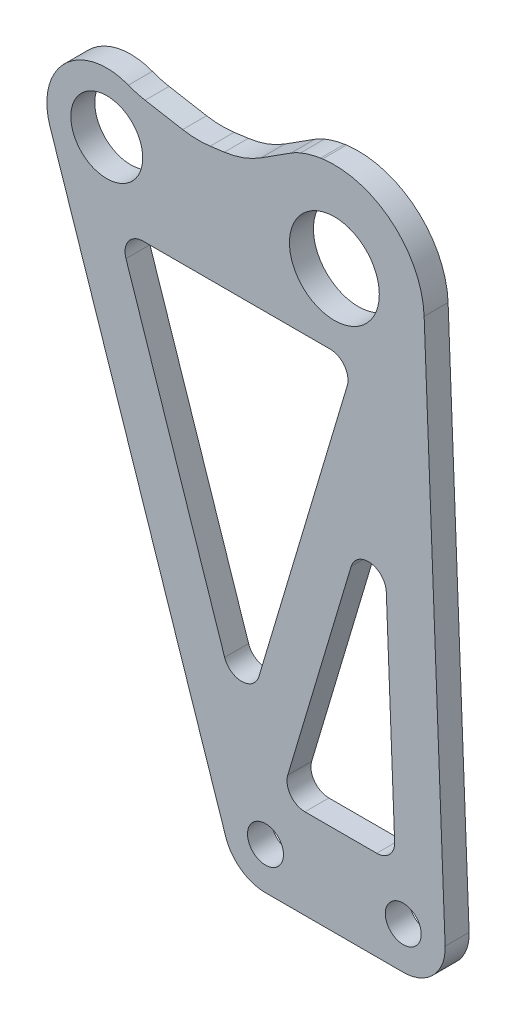
from build123d import *

# Parameters (mm, degrees)
SKETCH_1_R            = 3
SKETCH_1_R_2          = 7.5
SKETCH_1_R_3          = 6
EXTRUDE_1_DEPTH       = 4
CUT_EXTRUDE_START     = -10
CUT_EXTRUDE_2_DEPTH   = 10
CHAMFER_START         = -90.054290201
CHAMFER_2_OUTLINE_W   = 9.93243638
CHAMFER_2_OUTLINE_H   = 4
CHAMFER_2_DEPTH       = 0.082131492
CHAMFER_START_2       = -89.972158709
CHAMFER_2_2_OUTLINE_W = 9.93243638
CHAMFER_2_2_OUTLINE_H = 4
CHAMFER_2_2_DEPTH     = 1.179418362
FILLET_4_R            = 15
FILLET_5_R            = 10
CUT_EXTRUDE_6_DEPTH   = 10
FILLET_8_R            = 3


with BuildPart() as part:
    # 草图1 → 凸台-拉伸1 (new body)
    with BuildSketch(Plane.XY):
        with BuildLine():
            Line((-47.486974837, 85.838147942), (-18.140882386, -2.213296441))
            ThreePointArc((-18.140882386, -2.213296441), (-15.593099371, -5.678603485), (-11.5, -7))
            Line((-11.5, -7), (11.5, -7))
            ThreePointArc((11.5, -7), (16.545894038, -4.851695926), (18.494612442, 0.274584754))
            Line((18.494612442, 0.274584754), (14.988455233, 89.588395901))
            ThreePointArc((14.988455233, 89.588395901), (9.660960601, 100.474573642), (-1.973684211, 103.869585423))
            Line((-1.973684211, 103.869585423), (-39.315789474, 98.913056948))
            ThreePointArc((-39.315789474, 98.913056948), (-46.480167485, 94.299694277), (-47.486974837, 85.838147942))
        make_face()
        with Locations((11.5, 0)):
            Circle(SKETCH_1_R, mode=Mode.SUBTRACT)
        with Locations((-11.5, 0)):
            Circle(SKETCH_1_R, mode=Mode.SUBTRACT)
        with Locations((0, 89)):
            Circle(SKETCH_1_R_2, mode=Mode.SUBTRACT)
        with Locations((-38, 89)):
            Circle(SKETCH_1_R_3, mode=Mode.SUBTRACT)
    extrude(amount=EXTRUDE_1_DEPTH)

    # 草图3 → 切除-拉伸2 (cut)
    with BuildSketch(Plane.XY.offset(4).offset(CUT_EXTRUDE_START)):
        with BuildLine():
            Line((-30.07293559, 95.096035584), (-12.403974557, 97.441289229))
            ThreePointArc((-12.403974557, 97.441289229), (-8.018810771, 101.681191682), (-2.308312161, 103.825169261))
            Line((-2.308312161, 103.825169261), (-39.315789474, 98.913056948))
            ThreePointArc((-39.315789474, 98.913056948), (-34.182978636, 98.242853883), (-30.07293559, 95.096035584))
        make_face()
    extrude(amount=CUT_EXTRUDE_2_DEPTH, mode=Mode.SUBTRACT)

    # 倒角1
    # the kernel refuses this chamfer: 10 mm, written as the material it adds along each edge
    with BuildSketch(Plane(origin=(-30.07293559, 95.096035584, 0), x_dir=(-0.7655170404951253, 0.6434156205063604, 0), z_dir=(0, 0, 1))) as chamfer_1_piece_1:
        with BuildLine():
            Line((4.638446898, 0.2), (-5.12937843, -5.439456583))
            Line((-5.12937843, -5.439456583), (-5.277087929, -5.304616293))
            ThreePointArc((-5.277087929, -5.304616293), (-2.667716566, -2.625677211), (-0.147709499, 0.13484029))
            Line((-0.147709499, 0.13484029), (0.042920367, 0.195340324))
            ThreePointArc((0.042920367, 0.195340324), (2.321577959, -0.03141118), (4.595526531, 0.395340324))
            Line((4.595526531, 0.395340324), (4.638446898, 0.2))
        make_face()
    extrude(amount=4)

    # 倒角2: read off the stored shape, not the designer's step
    # 倒角2 outline → 倒角2 (cut)
    with BuildSketch(Plane(origin=(0, 0, 0), x_dir=(0.8432639594677478, 0.5374996694536441, 0), z_dir=(0.537499669453644, -0.8432639594677479, 0)).offset(CHAMFER_START)):
        with Locations((44.438996955, 2)):
            Rectangle(CHAMFER_2_OUTLINE_W, CHAMFER_2_OUTLINE_H)
    extrude(amount=CHAMFER_2_DEPTH, mode=Mode.SUBTRACT)

    # Chamfer 2 2 outline → Chamfer 2 2 (add)
    with BuildSketch(Plane(origin=(0, 0, 0), x_dir=(0.8432639594677478, 0.5374996694536441, 0), z_dir=(0.537499669453644, -0.8432639594677479, 0)).offset(CHAMFER_START_2)):
        with Locations((44.438996955, 2)):
            Rectangle(CHAMFER_2_2_OUTLINE_W, CHAMFER_2_2_OUTLINE_H)
    extrude(amount=CHAMFER_2_2_DEPTH)

    # 圆角4
    fillet_4_edges = [part.edges().sort_by_distance(p)[0] for p in [
        (-23.040343668, 96.029492385, 2),
        (-33.358562851, 97.857599065, 2),
        (-15.074033854, 97.086884333, 2),
    ]]
    fillet(fillet_4_edges, radius=FILLET_4_R)

    # 圆角5
    fillet_5_edges = [part.edges().sort_by_distance(p)[0] for p in [
        (-6.698368225, 102.425565605, 2),
    ]]
    fillet(fillet_5_edges, radius=FILLET_5_R)

    # 草图7 → 切除-拉伸6 (cut)
    with BuildSketch(Plane.XY.offset(4)):
        Polygon((3.302198464, 77), (-36.108751735, 77), (-15.314632791, 14.608313246), align=None)
        Polygon((10.185176898, 8), (7.961799494, 64.637023864), (-8.937918575, 8), align=None)
    extrude(amount=-CUT_EXTRUDE_6_DEPTH, mode=Mode.SUBTRACT)

    # 圆角8
    fillet_8_edges = [part.edges().sort_by_distance(p)[0] for p in [
        (7.961799494, 64.637023864, 2),
        (10.185176898, 8, 2),
        (-8.937918575, 8, 2),
        (3.302198464, 77, 2),
        (-15.314632791, 14.608313246, 2),
        (-36.108751735, 77, 2),
    ]]
    fillet(fillet_8_edges, radius=FILLET_8_R)


solid = part.part
